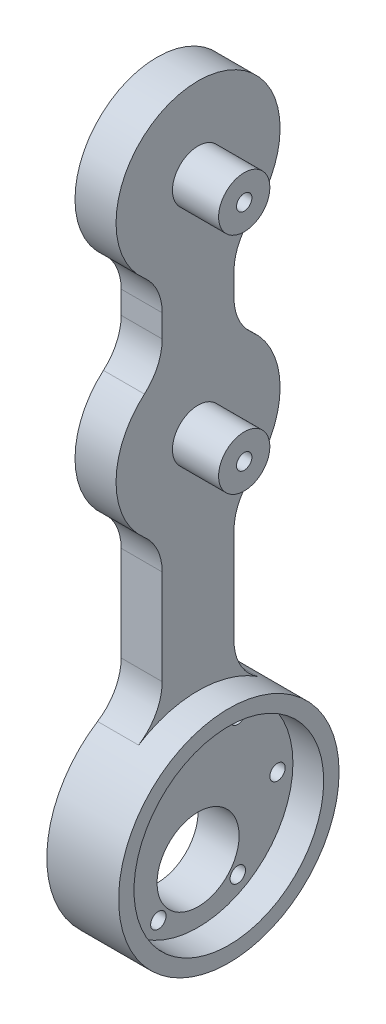
from build123d import *

# Parameters (mm, degrees)
BOSS_EXTRUDE1_DEPTH      = 4
BOSS_EXTRUDE1_DEPTH_BACK = 4
BOSS_EXTRUDE2_START      = 4
SKETCH1_3_R              = 5
BOSS_EXTRUDE2_DEPTH      = 9
SKETCH2_R                = 1.5
CUT_EXTRUDE1_DEPTH       = 17
SKETCH3_R                = 18.5
BOSS_EXTRUDE3_DEPTH      = 6
SKETCH4_R                = 8
SKETCH4_R_2              = 1.5
CUT_EXTRUDE2_DEPTH       = 14
FILLET1_R                = 10


with BuildPart() as part:
    # Sketch1 → Boss-Extrude1 (new, two sides: drawn at the far end of the back side and taken through both)
    with BuildSketch(Plane(origin=(0, 0, 0), x_dir=(0, 0, -1), z_dir=(1, 0, 0)).offset(-BOSS_EXTRUDE1_DEPTH_BACK)):
        with BuildLine():
            Line((-7, -14.38749457), (-7, -29.38749457))
            ThreePointArc((-7, -29.38749457), (-16, -43.77498914), (-7, -58.16248371))
            Line((-7, -58.16248371), (-7, -88.16248371))
            ThreePointArc((-7, -88.16248371), (0, -129.99103506), (7, -88.16248371))
            Line((7, -88.16248371), (7, -58.16248371))
            ThreePointArc((7, -58.16248371), (16, -43.77498914), (7, -29.38749457))
            Line((7, -29.38749457), (7, -14.38749457))
            ThreePointArc((7, -14.38749457), (0, 16), (-7, -14.38749457))
        make_face()
    extrude(amount=BOSS_EXTRUDE1_DEPTH + BOSS_EXTRUDE1_DEPTH_BACK)

    # Sketch1<3> → Boss-Extrude2 (add)
    with BuildSketch(Plane(origin=(0, 0, 0), x_dir=(0, 0, -1), z_dir=(1, 0, 0)).offset(BOSS_EXTRUDE2_START)):
        Circle(SKETCH1_3_R)
        with Locations((0, -43.77498914)):
            Circle(SKETCH1_3_R)
    extrude(amount=BOSS_EXTRUDE2_DEPTH)

    # Sketch2 → Cut-Extrude1 (cut)
    with BuildSketch(Plane.ZY.offset(4)):
        Circle(SKETCH2_R)
        with Locations((0, -43.77498914)):
            Circle(SKETCH2_R)
    extrude(amount=-CUT_EXTRUDE1_DEPTH, mode=Mode.SUBTRACT)

    # Sketch3 → Boss-Extrude3 (add)
    with BuildSketch(Plane(origin=(4, 0, 0), x_dir=(0, 0, -1), z_dir=(1, 0, 0))):
        with BuildLine():
            ThreePointArc((-7, -88.16248371), (-12.484990989, -125.994606124), (21.5, -108.49103506))
            ThreePointArc((21.5, -108.49103506), (17.503571064, -96.006044071), (7, -88.16248371))
            ThreePointArc((7, -88.16248371), (0, -86.99103506), (-7, -88.16248371))
        make_face()
        with Locations((0, -108.49103506)):
            Circle(SKETCH3_R, mode=Mode.SUBTRACT)
    extrude(amount=BOSS_EXTRUDE3_DEPTH)

    # Sketch4 → Cut-Extrude2 (cut)
    with BuildSketch(Plane.ZY.offset(4)):
        with Locations((0, -115.49103506)):
            Circle(SKETCH4_R)
        with Locations((15.496292799, -108.49103506)):
            Circle(SKETCH4_R_2)
        with Locations((7.7481464, -95.070851831)):
            Circle(SKETCH4_R_2)
        with Locations((-7.7481464, -95.070851831)):
            Circle(SKETCH4_R_2)
        with Locations((-15.496292799, -108.49103506)):
            Circle(SKETCH4_R_2)
        with Locations((-7.7481464, -121.911218289)):
            Circle(SKETCH4_R_2)
        with Locations((7.7481464, -121.911218289)):
            Circle(SKETCH4_R_2)
    extrude(amount=-CUT_EXTRUDE2_DEPTH, mode=Mode.SUBTRACT)

    # Fillet1
    # the kernel refuses this fillet: 10 mm, written as the material it adds along each edge
    with BuildSketch(Plane(origin=(-4, -29.38749457, 7), x_dir=(0, 1, 0), z_dir=(1, 0, 0)), Plane(origin=(4, -14.38749457, 7), x_dir=(0, -1, 0), z_dir=(-1, 0, 0)), Plane(origin=(4, -29.38749457, -7), x_dir=(0, 1, 0), z_dir=(-1, 0, 0))) as fillet1_piece_1:
        with BuildLine():
            CenterArc((5.284821003, 10), FILLET1_R, 220.832217027, 49.167782973)
            ThreePointArc((-2.281454217, 3.461538462), (-1.028137912, 1.804975281), (0, 0))
            Line((0, 0), (5.284821003, 0))
        make_face()
    extrude(amount=8)
    with BuildSketch(Plane(origin=(4, -14.38749457, -7), x_dir=(0, 0.5503109550569161, -0.8349597910943646), z_dir=(-1, 0, 0)), Plane(origin=(-4, -58.16248371, 7), x_dir=(0, 0.5503109550569153, 0.8349597910943651), z_dir=(1, 0, 0))) as fillet1_piece_2:
        with BuildLine():
            CenterArc((5.441303017, 9.915722591), FILLET1_R, 213.3883484, 49.167782973)
            Line((-2.908294893, 4.412613041), (0, 0))
            ThreePointArc((0, 0), (2.07287734, 0.134843854), (4.14575468, 0))
        make_face()
    extrude(amount=8)
    with BuildSketch(Plane(origin=(-4, -58.16248371, -7), x_dir=(0, 0.5503109550569155, -0.834959791094365), z_dir=(1, 0, 0))) as fillet1_piece_3:
        with BuildLine():
            CenterArc((5.441303017, -9.915722591), FILLET1_R, 97.443868628, 49.167782973)
            Line((-2.908294893, -4.412613041), (0, 0))
            ThreePointArc((0, 0), (2.07287734, -0.134843854), (4.14575468, 0))
        make_face()
    extrude(amount=8)
    with BuildSketch(Plane(origin=(-4, -88.16248371, -7), x_dir=(0, 1, 0), z_dir=(1, 0, 0))) as fillet1_piece_4:
        with BuildLine():
            CenterArc((6.190309862, -10), FILLET1_R, 90, 57.337969437)
            ThreePointArc((-2.228376237, -4.603174603), (-0.976831569, -2.368080993), (0, 0))
            Line((0, 0), (6.190309862, 0))
        make_face()
    extrude(amount=8)
    with BuildSketch(Plane(origin=(-4, -88.16248371, 7), x_dir=(0, -0.43572469735161884, 0.9000799898441472), z_dir=(1, 0, 0))) as fillet1_piece_5:
        with BuildLine():
            CenterArc((6.303529007, -9.929021011), FILLET1_R, 96.8306141, 57.337969437)
            Line((-2.697270891, -5.571774038), (0, 0))
            ThreePointArc((0, 0), (2.557091956, -0.152604826), (5.114183912, 0))
        make_face()
    extrude(amount=8)


solid = part.part
